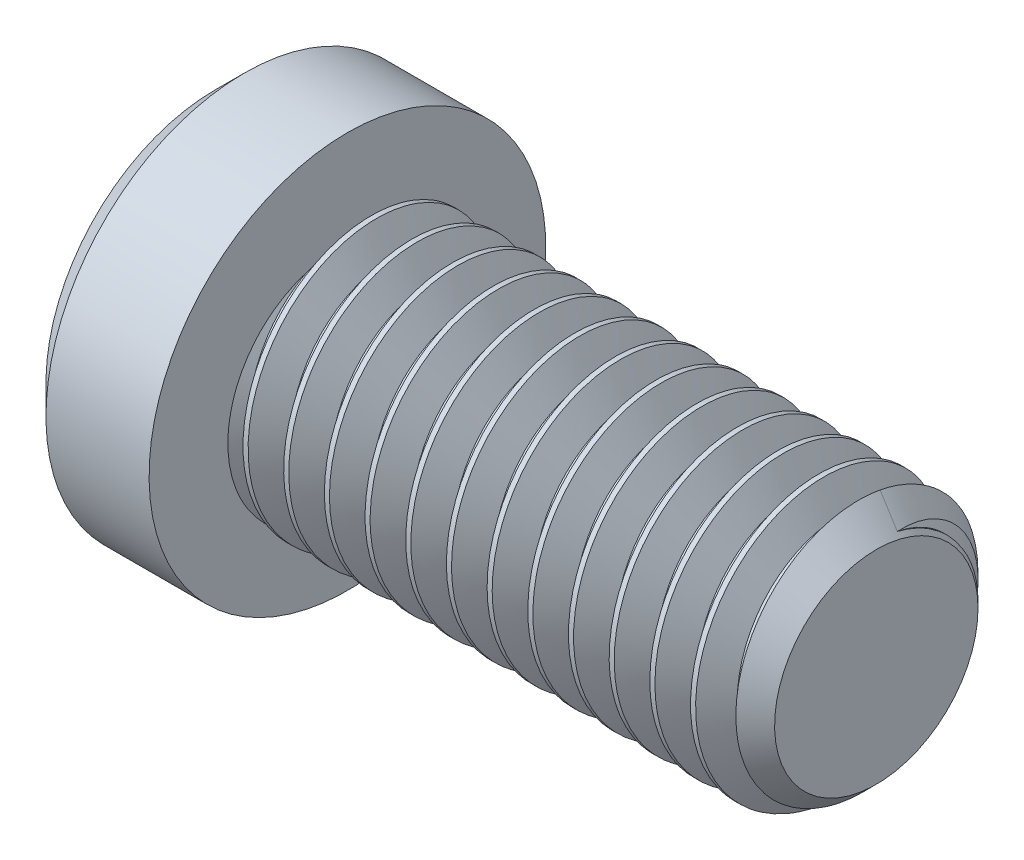
from build123d import *

# Parameters (mm, degrees)
SKETCH2_R           = 6.35
BOSS_EXTRUDE1_DEPTH = 25.4
CHAMFER1_SIZE       = 1.465384615
CUT_SWEEP1_PITCH    = 1.953846154
CUT_EXTRUDE1_DEPTH  = 3.8354


with BuildPart() as part:
    # Sketch2 → Boss-Extrude1 (new body)
    with BuildSketch(Plane(origin=(12.7, 0, 0), x_dir=(0, 0, -1), z_dir=(1, 0, 0))):
        Circle(SKETCH2_R)
    extrude(amount=-BOSS_EXTRUDE1_DEPTH)

    # Chamfer1
    chamfer1_edges = [part.edges().sort_by_distance(p)[0] for p in [
        (12.7, 0, 6.35),
    ]]
    chamfer(chamfer1_edges, length=CHAMFER1_SIZE)

    # Cut-Sweep1: the profile of Sketch5 profile screwed along a right-hand helix of 14 turns, 10 arcs to a turn; built about Z, then put on its axis
    cut_sweep1_z = Axis((0, 0, 0), (0, 0, 1))
    cut_sweep1_corners = [(6.3503, 0, 0.854980897), (6.3503, 0, -0.854980897), (5.080939697, 0, -0.122115385), (5.080939697, 0, 0.122115385)]
    with BuildLine(mode=Mode.PRIVATE) as cut_sweep1_profile:
        Line(cut_sweep1_corners[0], cut_sweep1_corners[1])
        Line(cut_sweep1_corners[1], cut_sweep1_corners[2])
        Line(cut_sweep1_corners[2], cut_sweep1_corners[3])
        Line(cut_sweep1_corners[3], cut_sweep1_corners[0])
    cut_sweep1_cap = Face(cut_sweep1_profile.wire())
    cut_sweep1_turn_angles = [0, 18, 36, 54, 72, 90, 108, 126, 144, 162, 180, 198, 216, 234, 252, 270, 288, 306, 324, 342, 360]
    cut_sweep1_turn_weights = [1, 0.9510565162951535, 1, 0.9510565162951535, 1, 0.9510565162951535, 1, 0.9510565162951535, 1, 0.9510565162951535, 1, 0.9510565162951535, 1, 0.9510565162951535, 1, 0.9510565162951535, 1, 0.9510565162951535, 1, 0.9510565162951535, 1]
    cut_sweep1_turn_rails = [Edge.make_bspline([Vector(p[0], p[1], 0).rotate(cut_sweep1_z, cut_sweep1_turn_angles[k]) / cut_sweep1_turn_weights[k] + Vector(0, 0, p[2] + CUT_SWEEP1_PITCH * cut_sweep1_turn_angles[k] / 360) for k in range(21)], [0, 0, 0, 1, 1, 2, 2, 3, 3, 4, 4, 5, 5, 6, 6, 7, 7, 8, 8, 9, 9, 10, 10, 10], 2, cut_sweep1_turn_weights) for p in cut_sweep1_corners]
    cut_sweep1_turn_sides = [Face.make_surface_from_curves(cut_sweep1_turn_rails[p[0]], cut_sweep1_turn_rails[p[1]]) for p in [(0, 1), (1, 2), (2, 3), (3, 0)]]
    cut_sweep1 = Plane(origin=(12.7, 0, 0), x_dir=(0, 1, 0), z_dir=(-1, 0, 0)) * Solid(Shell([*[p.moved(Location((0, 0, CUT_SWEEP1_PITCH * i))) for i in range(14) for p in cut_sweep1_turn_sides], cut_sweep1_cap, cut_sweep1_cap.rotate(cut_sweep1_z, 5040).moved(Location((0, 0, CUT_SWEEP1_PITCH * 5040 / 360)))]))
    add(cut_sweep1, mode=Mode.SUBTRACT)

    # Sketch6 → Revolve1 (revolve)
    with BuildSketch(Plane.XY, mode=Mode.PRIVATE) as revolve1_sk:
        Polygon((-17.653, 9.525), (-19.05, 8.128), (-19.05, 0), (-12.7, 0), (-12.7, 9.525), align=None)
    revolve(revolve1_sk.sketch.rotate(Axis((-12.7, 0, 0), (-1, 0, 0)), 13.740040815), axis=Axis((-12.7, 0, 0), (-1, 0, 0)))

    # Sketch4 → Cut-Extrude1 (cut)
    with BuildSketch(Plane(origin=(-19.05, 0, 0), x_dir=(0, 0, -1), z_dir=(1, 0, 0))):
        Polygon((0, 3.666174209), (-3.175, 1.833087105), (-3.175, -1.833087105), (0, -3.666174209), (3.175, -1.833087105), (3.175, 1.833087105), align=None)
    extrude(amount=CUT_EXTRUDE1_DEPTH, mode=Mode.SUBTRACT)

    # Cut-Extrude2 cone 1 section (through the dimple's axis) → Cut-Extrude2 (revolve, cut)
    with BuildSketch(Plane(origin=(-19.05, 0, 0), x_dir=(0, 0, 1), z_dir=(0, 1, 0))):
        Polygon((0, 0), (3.666174209, 0), (0, 3.666174209), align=None)
    revolve(axis=Axis((-19.05, 0, 0), (1, 0, 0)), mode=Mode.SUBTRACT)


solid = part.part
